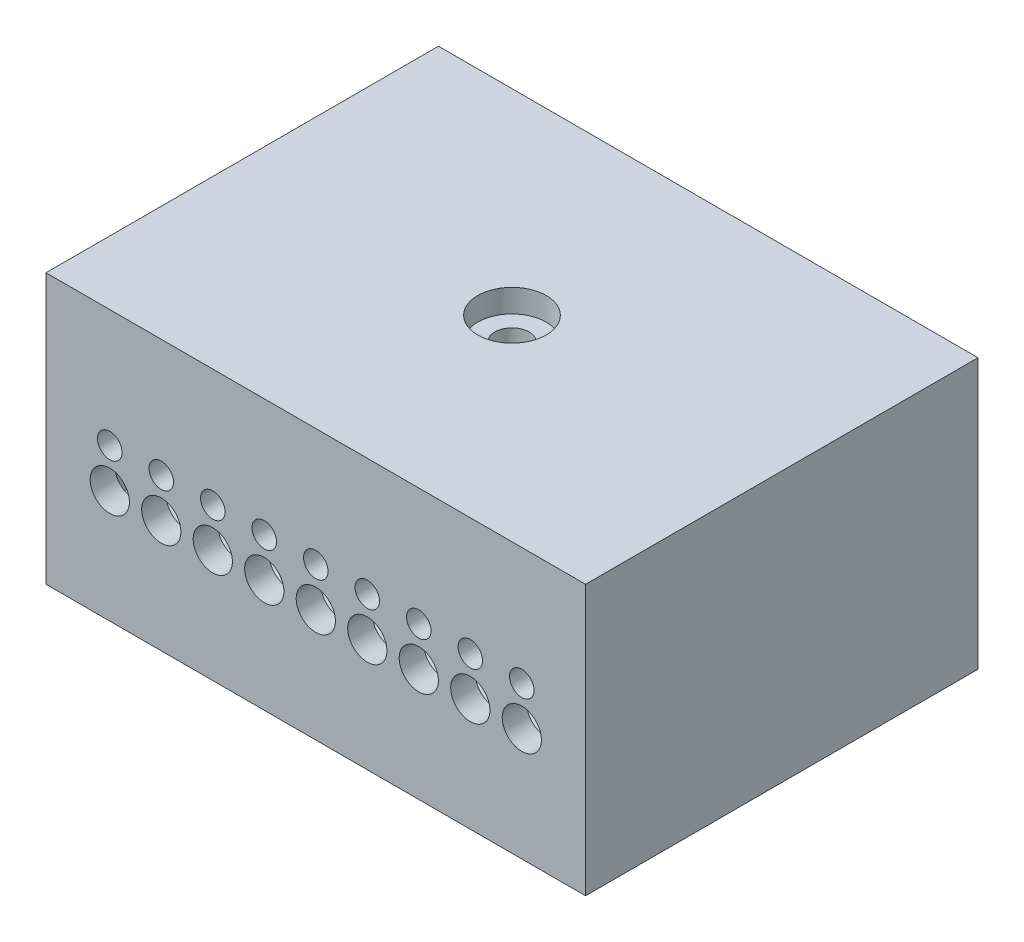
from build123d import *

# Parameters (mm, degrees)
SKETCH2_W                                        = 110
SKETCH2_H                                        = 55
BOSS_EXTRUDE1_DEPTH                              = 80
SKETCH4_W                                        = 90
SKETCH4_H                                        = 60
CUT_EXTRUDE2_DEPTH                               = 10
CUT_EXTRUDE2_DRAFT                               = -20
CBORE_FOR_M6_HEX_HEAD_MACHINE_SCREW1_D           = 7
CBORE_FOR_M6_HEX_HEAD_MACHINE_SCREW1_CBORE_D     = 13.95
CBORE_FOR_M6_HEX_HEAD_MACHINE_SCREW1_CBORE_DEPTH = 4.7
SHELL4_START                                     = 15
SHELL4_OUTLINE_W                                 = 100
SHELL4_OUTLINE_H                                 = 75
SHELL4_OUTLINE_R                                 = 11.975
SHELL4_DEPTH                                     = 35
SHELL4_2_OUTLINE_R                               = 11.975
SHELL4_2_OUTLINE_R_2                             = 8.5
SHELL4_2_DEPTH                                   = 30.3
SHELL4_3_OUTLINE_W                               = 100
SHELL4_3_OUTLINE_H                               = 10
SHELL4_3_DEPTH                                   = 2.859259966
SHELL4_4_DEPTH                                   = 75
SHELL4_START_2                                   = 5
SHELL4_5_DEPTH                                   = 100
CUT_EXTRUDE4_REACH                               = 146.049
SKETCH8_R                                        = 2.5
SKETCH8_R_2                                      = 4


with BuildPart() as part:
    # Sketch2 → Boss-Extrude1 (new body)
    with BuildSketch(Plane.XY):
        with Locations((55, 27.5)):
            Rectangle(SKETCH2_W, SKETCH2_H)
    extrude(amount=BOSS_EXTRUDE1_DEPTH)


with BuildPart() as cut_extrude2_tool:
    # Sketch4 → Cut-Extrude2 (with draft: the straight prism first)
    with BuildSketch(Plane(origin=(0, 10, 0), x_dir=(-1, 0, 0), z_dir=(0, -1, 0))):
        with Locations((-55, -40)):
            Rectangle(SKETCH4_W, SKETCH4_H)
    extrude(amount=CUT_EXTRUDE2_DEPTH)
    # Cut-Extrude2: the draft: its side faces are tilted about the plane it starts from
    cut_extrude2_sides = [cut_extrude2_tool.faces().sort_by_distance(p)[0] for p in [
        (55, 5, 70),
        (10, 5, 40),
        (55, 5, 10),
        (100, 5, 40),
    ]]
    draft(cut_extrude2_sides, Plane(origin=(0, 10, 0), x_dir=(-1, 0, 0), z_dir=(0, -1, 0)), CUT_EXTRUDE2_DRAFT)


with BuildPart() as part_1:
    add(part.part)

    # Cut-Extrude2: cut by cut_extrude2_tool
    add(cut_extrude2_tool.part, mode=Mode.SUBTRACT)

    # CBORE for M6 Hex Head Machine Screw1 (through all)
    with Locations(Plane(origin=(0, 55, 0), x_dir=(1, 0, 0), z_dir=(0, 1, 0))):
        with Locations((55, -40)):
            CounterBoreHole(CBORE_FOR_M6_HEX_HEAD_MACHINE_SCREW1_D / 2, CBORE_FOR_M6_HEX_HEAD_MACHINE_SCREW1_CBORE_D / 2, CBORE_FOR_M6_HEX_HEAD_MACHINE_SCREW1_CBORE_DEPTH)

    # Shell4: read off the stored shape, not the designer's step
    # Shell4 outline → Shell4 (cut)
    with BuildSketch(Plane(origin=(0, 0, 0), x_dir=(1, 0, 0), z_dir=(0, 1, 0)).offset(SHELL4_START)):
        with Locations((55, -37.5)):
            Rectangle(SHELL4_OUTLINE_W, SHELL4_OUTLINE_H)
        with Locations((55, -40)):
            Circle(SHELL4_OUTLINE_R, mode=Mode.SUBTRACT)
    extrude(amount=SHELL4_DEPTH, mode=Mode.SUBTRACT)

    # Shell4 2 outline → Shell4 2 (cut)
    with BuildSketch(Plane(origin=(0, 0, 0), x_dir=(1, 0, 0), z_dir=(0, 1, 0)).offset(SHELL4_START)):
        with Locations((55, -40)):
            Circle(SHELL4_2_OUTLINE_R)
        with Locations((55, -40)):
            Circle(SHELL4_2_OUTLINE_R_2, mode=Mode.SUBTRACT)
    extrude(amount=SHELL4_2_DEPTH, mode=Mode.SUBTRACT)

    # Shell4 3 outline → Shell4 3 (cut)
    with BuildSketch(Plane.XY):
        with Locations((55, 10)):
            Rectangle(SHELL4_3_OUTLINE_W, SHELL4_3_OUTLINE_H)
    extrude(amount=SHELL4_3_DEPTH, mode=Mode.SUBTRACT)

    # Shell4 4 outline → Shell4 4 (cut)
    with BuildSketch(Plane.XY):
        Polygon((103.501037691, 15), (105, 10.881634904), (105, 15), align=None)
        Polygon((5, 15), (5, 10.881634904), (6.498962309, 15), align=None)
    extrude(amount=SHELL4_4_DEPTH, mode=Mode.SUBTRACT)

    # Shell4 5 outline → Shell4 5 (cut)
    with BuildSketch(Plane.YZ.offset(SHELL4_START_2)):
        Polygon((15, 2.859259966), (15, 6.498962309), (5, 2.859259966), align=None)
        Polygon((15, 75), (10.881634904, 75), (15, 73.501037691), align=None)
    extrude(amount=SHELL4_5_DEPTH, mode=Mode.SUBTRACT)

    # Sketch8 → Cut-Extrude4 (cut, up to next)
    with BuildSketch(Plane(origin=(0, 0, 75), x_dir=(-1, 0, 0), z_dir=(0, 0, -1)), mode=Mode.PRIVATE) as cut_extrude4_sk1:
        with Locations((-97, 31)):
            Circle(SKETCH8_R)
    cut_extrude4_tool1 = extrude(cut_extrude4_sk1.sketch, amount=-CUT_EXTRUDE4_REACH, mode=Mode.PRIVATE) & part_1.part
    # Sketch8 → Cut-Extrude4 (cut, up to next)
    with BuildSketch(Plane(origin=(0, 0, 75), x_dir=(-1, 0, 0), z_dir=(0, 0, -1)), mode=Mode.PRIVATE) as cut_extrude4_sk2:
        with Locations((-97, 23)):
            Circle(SKETCH8_R_2)
    cut_extrude4_tool2 = extrude(cut_extrude4_sk2.sketch, amount=-CUT_EXTRUDE4_REACH, mode=Mode.PRIVATE) & part_1.part
    # Sketch8 → Cut-Extrude4 (cut, up to next)
    with BuildSketch(Plane(origin=(0, 0, 75), x_dir=(-1, 0, 0), z_dir=(0, 0, -1)), mode=Mode.PRIVATE) as cut_extrude4_sk3:
        with Locations((-86.5, 31)):
            Circle(SKETCH8_R)
    cut_extrude4_tool3 = extrude(cut_extrude4_sk3.sketch, amount=-CUT_EXTRUDE4_REACH, mode=Mode.PRIVATE) & part_1.part
    # Sketch8 → Cut-Extrude4 (cut, up to next)
    with BuildSketch(Plane(origin=(0, 0, 75), x_dir=(-1, 0, 0), z_dir=(0, 0, -1)), mode=Mode.PRIVATE) as cut_extrude4_sk4:
        with Locations((-86.5, 23)):
            Circle(SKETCH8_R_2)
    cut_extrude4_tool4 = extrude(cut_extrude4_sk4.sketch, amount=-CUT_EXTRUDE4_REACH, mode=Mode.PRIVATE) & part_1.part
    # Sketch8 → Cut-Extrude4 (cut, up to next)
    with BuildSketch(Plane(origin=(0, 0, 75), x_dir=(-1, 0, 0), z_dir=(0, 0, -1)), mode=Mode.PRIVATE) as cut_extrude4_sk5:
        with Locations((-76, 31)):
            Circle(SKETCH8_R)
    cut_extrude4_tool5 = extrude(cut_extrude4_sk5.sketch, amount=-CUT_EXTRUDE4_REACH, mode=Mode.PRIVATE) & part_1.part
    # Sketch8 → Cut-Extrude4 (cut, up to next)
    with BuildSketch(Plane(origin=(0, 0, 75), x_dir=(-1, 0, 0), z_dir=(0, 0, -1)), mode=Mode.PRIVATE) as cut_extrude4_sk6:
        with Locations((-76, 23)):
            Circle(SKETCH8_R_2)
    cut_extrude4_tool6 = extrude(cut_extrude4_sk6.sketch, amount=-CUT_EXTRUDE4_REACH, mode=Mode.PRIVATE) & part_1.part
    # Sketch8 → Cut-Extrude4 (cut, up to next)
    with BuildSketch(Plane(origin=(0, 0, 75), x_dir=(-1, 0, 0), z_dir=(0, 0, -1)), mode=Mode.PRIVATE) as cut_extrude4_sk7:
        with Locations((-65.5, 31)):
            Circle(SKETCH8_R)
    cut_extrude4_tool7 = extrude(cut_extrude4_sk7.sketch, amount=-CUT_EXTRUDE4_REACH, mode=Mode.PRIVATE) & part_1.part
    # Sketch8 → Cut-Extrude4 (cut, up to next)
    with BuildSketch(Plane(origin=(0, 0, 75), x_dir=(-1, 0, 0), z_dir=(0, 0, -1)), mode=Mode.PRIVATE) as cut_extrude4_sk8:
        with Locations((-65.5, 23)):
            Circle(SKETCH8_R_2)
    cut_extrude4_tool8 = extrude(cut_extrude4_sk8.sketch, amount=-CUT_EXTRUDE4_REACH, mode=Mode.PRIVATE) & part_1.part
    # Sketch8 → Cut-Extrude4 (cut, up to next)
    with BuildSketch(Plane(origin=(0, 0, 75), x_dir=(-1, 0, 0), z_dir=(0, 0, -1)), mode=Mode.PRIVATE) as cut_extrude4_sk9:
        with Locations((-55, 31)):
            Circle(SKETCH8_R)
    cut_extrude4_tool9 = extrude(cut_extrude4_sk9.sketch, amount=-CUT_EXTRUDE4_REACH, mode=Mode.PRIVATE) & part_1.part
    # Sketch8 → Cut-Extrude4 (cut, up to next)
    with BuildSketch(Plane(origin=(0, 0, 75), x_dir=(-1, 0, 0), z_dir=(0, 0, -1)), mode=Mode.PRIVATE) as cut_extrude4_sk10:
        with Locations((-55, 23)):
            Circle(SKETCH8_R_2)
    cut_extrude4_tool10 = extrude(cut_extrude4_sk10.sketch, amount=-CUT_EXTRUDE4_REACH, mode=Mode.PRIVATE) & part_1.part
    # Sketch8 → Cut-Extrude4 (cut, up to next)
    with BuildSketch(Plane(origin=(0, 0, 75), x_dir=(-1, 0, 0), z_dir=(0, 0, -1)), mode=Mode.PRIVATE) as cut_extrude4_sk11:
        with Locations((-44.5, 31)):
            Circle(SKETCH8_R)
    cut_extrude4_tool11 = extrude(cut_extrude4_sk11.sketch, amount=-CUT_EXTRUDE4_REACH, mode=Mode.PRIVATE) & part_1.part
    # Sketch8 → Cut-Extrude4 (cut, up to next)
    with BuildSketch(Plane(origin=(0, 0, 75), x_dir=(-1, 0, 0), z_dir=(0, 0, -1)), mode=Mode.PRIVATE) as cut_extrude4_sk12:
        with Locations((-44.5, 23)):
            Circle(SKETCH8_R_2)
    cut_extrude4_tool12 = extrude(cut_extrude4_sk12.sketch, amount=-CUT_EXTRUDE4_REACH, mode=Mode.PRIVATE) & part_1.part
    # Sketch8 → Cut-Extrude4 (cut, up to next)
    with BuildSketch(Plane(origin=(0, 0, 75), x_dir=(-1, 0, 0), z_dir=(0, 0, -1)), mode=Mode.PRIVATE) as cut_extrude4_sk13:
        with Locations((-34, 31)):
            Circle(SKETCH8_R)
    cut_extrude4_tool13 = extrude(cut_extrude4_sk13.sketch, amount=-CUT_EXTRUDE4_REACH, mode=Mode.PRIVATE) & part_1.part
    # Sketch8 → Cut-Extrude4 (cut, up to next)
    with BuildSketch(Plane(origin=(0, 0, 75), x_dir=(-1, 0, 0), z_dir=(0, 0, -1)), mode=Mode.PRIVATE) as cut_extrude4_sk14:
        with Locations((-34, 23)):
            Circle(SKETCH8_R_2)
    cut_extrude4_tool14 = extrude(cut_extrude4_sk14.sketch, amount=-CUT_EXTRUDE4_REACH, mode=Mode.PRIVATE) & part_1.part
    # Sketch8 → Cut-Extrude4 (cut, up to next)
    with BuildSketch(Plane(origin=(0, 0, 75), x_dir=(-1, 0, 0), z_dir=(0, 0, -1)), mode=Mode.PRIVATE) as cut_extrude4_sk15:
        with Locations((-23.5, 31)):
            Circle(SKETCH8_R)
    cut_extrude4_tool15 = extrude(cut_extrude4_sk15.sketch, amount=-CUT_EXTRUDE4_REACH, mode=Mode.PRIVATE) & part_1.part
    # Sketch8 → Cut-Extrude4 (cut, up to next)
    with BuildSketch(Plane(origin=(0, 0, 75), x_dir=(-1, 0, 0), z_dir=(0, 0, -1)), mode=Mode.PRIVATE) as cut_extrude4_sk16:
        with Locations((-23.5, 23)):
            Circle(SKETCH8_R_2)
    cut_extrude4_tool16 = extrude(cut_extrude4_sk16.sketch, amount=-CUT_EXTRUDE4_REACH, mode=Mode.PRIVATE) & part_1.part
    # Sketch8 → Cut-Extrude4 (cut, up to next)
    with BuildSketch(Plane(origin=(0, 0, 75), x_dir=(-1, 0, 0), z_dir=(0, 0, -1)), mode=Mode.PRIVATE) as cut_extrude4_sk17:
        with Locations((-13, 31)):
            Circle(SKETCH8_R)
    cut_extrude4_tool17 = extrude(cut_extrude4_sk17.sketch, amount=-CUT_EXTRUDE4_REACH, mode=Mode.PRIVATE) & part_1.part
    # Sketch8 → Cut-Extrude4 (cut, up to next)
    with BuildSketch(Plane(origin=(0, 0, 75), x_dir=(-1, 0, 0), z_dir=(0, 0, -1)), mode=Mode.PRIVATE) as cut_extrude4_sk18:
        with Locations((-13, 23)):
            Circle(SKETCH8_R_2)
    cut_extrude4_tool18 = extrude(cut_extrude4_sk18.sketch, amount=-CUT_EXTRUDE4_REACH, mode=Mode.PRIVATE) & part_1.part
    add(cut_extrude4_tool1.solids().sort_by_distance((97, 31, 75))[0], mode=Mode.SUBTRACT)
    add(cut_extrude4_tool2.solids().sort_by_distance((97, 23, 75))[0], mode=Mode.SUBTRACT)
    add(cut_extrude4_tool3.solids().sort_by_distance((86.5, 31, 75))[0], mode=Mode.SUBTRACT)
    add(cut_extrude4_tool4.solids().sort_by_distance((86.5, 23, 75))[0], mode=Mode.SUBTRACT)
    add(cut_extrude4_tool5.solids().sort_by_distance((76, 31, 75))[0], mode=Mode.SUBTRACT)
    add(cut_extrude4_tool6.solids().sort_by_distance((76, 23, 75))[0], mode=Mode.SUBTRACT)
    add(cut_extrude4_tool7.solids().sort_by_distance((65.5, 31, 75))[0], mode=Mode.SUBTRACT)
    add(cut_extrude4_tool8.solids().sort_by_distance((65.5, 23, 75))[0], mode=Mode.SUBTRACT)
    add(cut_extrude4_tool9.solids().sort_by_distance((55, 31, 75))[0], mode=Mode.SUBTRACT)
    add(cut_extrude4_tool10.solids().sort_by_distance((55, 23, 75))[0], mode=Mode.SUBTRACT)
    add(cut_extrude4_tool11.solids().sort_by_distance((44.5, 31, 75))[0], mode=Mode.SUBTRACT)
    add(cut_extrude4_tool12.solids().sort_by_distance((44.5, 23, 75))[0], mode=Mode.SUBTRACT)
    add(cut_extrude4_tool13.solids().sort_by_distance((34, 31, 75))[0], mode=Mode.SUBTRACT)
    add(cut_extrude4_tool14.solids().sort_by_distance((34, 23, 75))[0], mode=Mode.SUBTRACT)
    add(cut_extrude4_tool15.solids().sort_by_distance((23.5, 31, 75))[0], mode=Mode.SUBTRACT)
    add(cut_extrude4_tool16.solids().sort_by_distance((23.5, 23, 75))[0], mode=Mode.SUBTRACT)
    add(cut_extrude4_tool17.solids().sort_by_distance((13, 31, 75))[0], mode=Mode.SUBTRACT)
    add(cut_extrude4_tool18.solids().sort_by_distance((13, 23, 75))[0], mode=Mode.SUBTRACT)


solid = part_1.part
